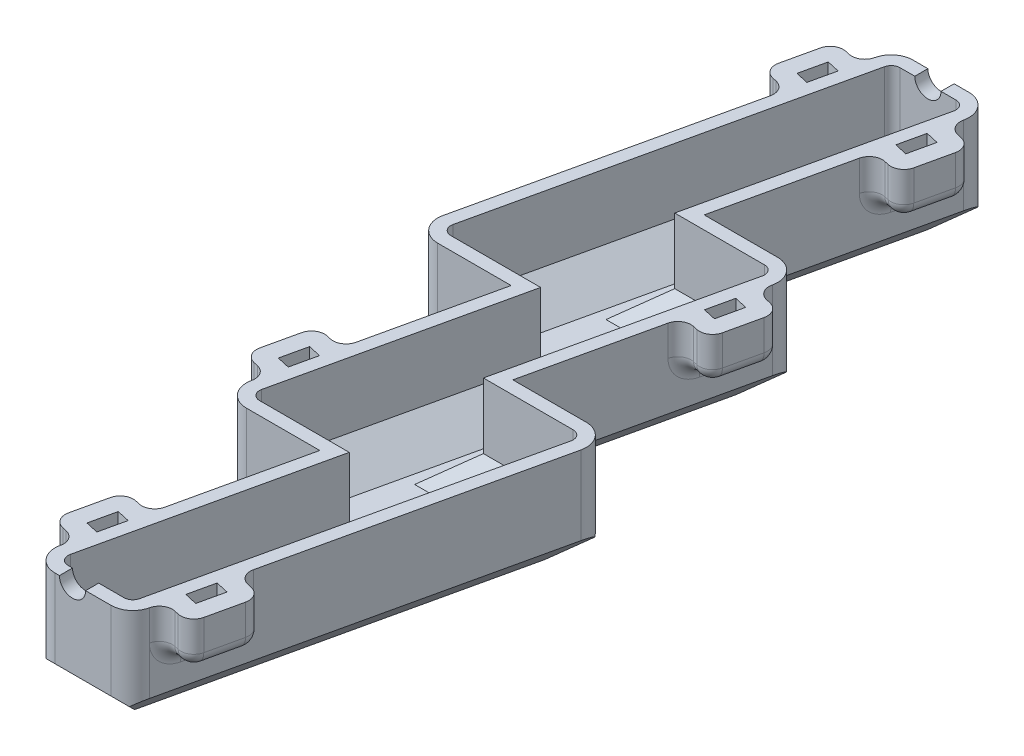
from build123d import *

# Parameters (mm, degrees)
BOSS_EXTRUDE1_DEPTH = 25
CUT_EXTRUDE1_DEPTH  = 22
CHAMFER2_SIZE       = 7
FILLET4_R           = 5
FILLET5_R           = 2
BOSS_EXTRUDE2_DEPTH = 10
FILLET6_R           = 3
SKETCH30_R          = 3
CUT_EXTRUDE2_DEPTH  = 10
SKETCH31_R          = 3
CUT_EXTRUDE3_DEPTH  = 10


with BuildPart() as part:
    # Sketch1 → Boss-Extrude1 (new body)
    with BuildSketch(Plane(origin=(0, 0, 0), x_dir=(1, 0, 0), z_dir=(0, 1, 0))):
        Polygon((-1.350541496, 45.372193924), (21.708735773, 45.372193924), (1.350541496, -45.372193924), (-21.708735773, -45.372193924), align=None)
        Polygon((12.154256572, -100), (-10.905020697, -100), (9.453173579, -9.255612153), (32.512450848, -9.255612153), align=None)
        Polygon((-12.154256572, 100), (10.905020697, 100), (-9.453173579, 9.255612153), (-32.512450848, 9.255612153), align=None)
    extrude(amount=BOSS_EXTRUDE1_DEPTH)

    # Sketch4 → Cut-Extrude1 (cut)
    with BuildSketch(Plane(origin=(0, 25, 0), x_dir=(1, 0, 0), z_dir=(0, 1, 0))):
        Polygon((-9.752726049, 97), (-28.764840766, 12.255612153), (-11.854704102, 12.255612153), (7.157410615, 97), align=None)
        Polygon((1.050989026, 42.372193924), (-5.098151579, 42.372193924), (-11.854704102, 12.255612153), (-5.705563497, 12.255612153), align=None)
        Polygon((1.050989026, 42.372193924), (-17.96112569, -42.372193924), (-1.050989026, -42.372193924), (17.96112569, 42.372193924), align=None)
        Polygon((11.854704102, -12.255612153), (-7.157410615, -97), (9.752726049, -97), (28.764840766, -12.255612153), align=None)
        Polygon((11.854704102, -12.255612153), (5.705563497, -12.255612153), (-1.050989026, -42.372193924), (5.098151579, -42.372193924), align=None)
    extrude(amount=-CUT_EXTRUDE1_DEPTH, mode=Mode.SUBTRACT)

    # Chamfer2
    chamfer2_edges = [part.edges().sort_by_distance(p)[0] for p in [
        (0.624617937, 0, 100),
        (-4.7772396, 0, 72.686096962),
        (-10.179097138, 0, 45.372193924),
        (-15.580954676, 0, 18.058290886),
        (-20.982812214, 0, -9.255612153),
        (-22.33335371, 0, -54.627806076),
        (-0.624617937, 0, -100),
        (4.7772396, 0, -72.686096962),
        (10.179097138, 0, -45.372193924),
        (15.580954676, 0, -18.058290886),
        (20.982812214, 0, 9.255612153),
        (22.33335371, 0, 54.627806076),
        (-19.258783408, 3, -54.627806076),
        (6.431487056, 3, -42.372193924),
        (17.235202131, 3, 12.255612153),
        (1.297657717, 3, 97),
        (-1.029629518, 3, 69.686096962),
        (-6.431487056, 3, 42.372193924),
        (-11.833344593, 3, 15.058290886),
        (-17.235202131, 3, -12.255612153),
        (-1.297657717, 3, -97),
        (1.029629518, 3, -69.686096962),
        (11.833344593, 3, -15.058290886),
        (19.258783408, 3, 54.627806076),
    ]]
    chamfer(chamfer2_edges, length=CHAMFER2_SIZE)

    # Fillet4
    fillet4_edges = [part.edges().sort_by_distance(p)[0] for p in [
        (12.154256572, 16, 100),
        (-10.905020697, 16, 100),
        (-21.708735773, 16, 45.372193924),
        (-32.512450848, 16, -9.255612153),
        (-12.154256572, 16, -100),
        (10.905020697, 16, -100),
        (21.708735773, 16, -45.372193924),
        (32.512450848, 16, 9.255612153),
    ]]
    fillet(fillet4_edges, radius=FILLET4_R)

    # Fillet5
    fillet5_edges = [part.edges().sort_by_distance(p)[0] for p in [
        (7.157410615, 17.5, -97),
        (17.96112569, 17.5, -42.372193924),
        (28.764840766, 17.5, 12.255612153),
        (9.752726049, 17.5, 97),
        (-7.157410615, 17.5, 97),
        (-17.96112569, 17.5, 42.372193924),
        (-28.764840766, 17.5, -12.255612153),
        (-9.752726049, 17.5, -97),
    ]]
    fillet(fillet5_edges, radius=FILLET5_R)

    # Sketch29 → Boss-Extrude2 (add)
    with BuildSketch(Plane(origin=(0, 25, 0), x_dir=(1, 0, 0), z_dir=(0, 1, 0))):
        Polygon((15.711241219, 89.445897905), (8.881018478, 90.978235108), (8.005397219, 87.075250685), (10.932635537, 86.41853474), (9.619203648, 80.564058105), (6.69196533, 81.220774049), (5.816344071, 77.317789626), (12.646566812, 75.785452422), align=None)
        Polygon((-14.562773434, 89.264303833), (-13.687152175, 93.167288256), (-20.517374916, 94.69962546), (-23.582049323, 81.039179978), (-16.751826582, 79.506842774), (-15.876205323, 83.409827197), (-18.80344364, 84.066543142), (-17.490011752, 89.921019777), align=None)
        Polygon((26.514956295, 34.818091828), (19.684733554, 36.350429032), (18.809112294, 32.447444609), (21.736350612, 31.790728664), (20.422918723, 25.936252029), (17.495680406, 26.592967973), (16.620059146, 22.68998355), (23.450281888, 21.157646346), align=None)
        Polygon((-26.514956295, -34.818091828), (-19.684733554, -36.350429032), (-18.809112294, -32.447444609), (-21.736350612, -31.790728664), (-20.422918723, -25.936252029), (-17.495680406, -26.592967973), (-16.620059146, -22.68998355), (-23.450281888, -21.157646346), align=None)
        Polygon((-15.711241219, -89.445897905), (-8.881018478, -90.978235108), (-8.005397219, -87.075250685), (-10.932635537, -86.41853474), (-9.619203648, -80.564058105), (-6.69196533, -81.220774049), (-5.816344071, -77.317789626), (-12.646566812, -75.785452422), align=None)
        Polygon((14.562773434, -89.264303833), (13.687152175, -93.167288256), (20.517374916, -94.69962546), (23.582049323, -81.039179978), (16.751826582, -79.506842774), (15.876205323, -83.409827197), (18.80344364, -84.066543142), (17.490011752, -89.921019777), align=None)
    extrude(amount=-BOSS_EXTRUDE2_DEPTH)

    # Fillet6
    fillet6_edges = [part.edges().sort_by_distance(p)[0] for p in [
        (16.620059146, 20, -22.68998355),
        (19.684733554, 20, -36.350429032),
        (5.816344071, 20, -77.317789626),
        (8.881018478, 20, -90.978235108),
        (-13.687152175, 20, -93.167288256),
        (-16.751826582, 20, -79.506842774),
        (-16.620059146, 20, 22.68998355),
        (-19.684733554, 20, 36.350429032),
        (-8.881018478, 20, 90.978235108),
        (-5.816344071, 20, 77.317789626),
        (13.687152175, 20, 93.167288256),
        (16.751826582, 20, 79.506842774),
        (23.450281888, 20, -21.157646346),
        (20.035170517, 15, -21.923814948),
        (17.057869776, 15, -24.641475761),
        (19.246922924, 15, -34.39893682),
        (24.982619091, 15, -27.987869087),
        (23.099844924, 15, -35.58426043),
        (26.514956295, 20, -34.818091828),
        (6.2541547, 15, -79.269281838),
        (8.443207848, 15, -89.026742897),
        (9.231455441, 15, -76.551621024),
        (12.646566812, 20, -75.785452422),
        (14.178904016, 15, -82.615675164),
        (15.711241219, 20, -89.445897905),
        (12.296129849, 15, -90.212066507),
        (-17.102263545, 15, -93.933456858),
        (-20.517374916, 20, -94.69962546),
        (-23.582049323, 20, -81.039179978),
        (-20.166937953, 15, -80.273011376),
        (-16.314015952, 15, -81.458334986),
        (-22.04971212, 15, -87.869402719),
        (-14.124962804, 15, -91.215796045),
        (-23.450281888, 20, 21.157646346),
        (-17.057869776, 15, 24.641475761),
        (-20.035170517, 15, 21.923814948),
        (-24.982619091, 15, 27.987869087),
        (-26.514956295, 20, 34.818091828),
        (-19.246922924, 15, 34.39893682),
        (-23.099844924, 15, 35.58426043),
        (-12.646566812, 20, 75.785452422),
        (-15.711241219, 20, 89.445897905),
        (-14.178904016, 15, 82.615675164),
        (-8.443207848, 15, 89.026742897),
        (-12.296129849, 15, 90.212066507),
        (-9.231455441, 15, 76.551621024),
        (-6.2541547, 15, 79.269281838),
        (14.124962804, 15, 91.215796045),
        (16.314015952, 15, 81.458334986),
        (20.517374916, 20, 94.69962546),
        (17.102263545, 15, 93.933456858),
        (22.04971212, 15, 87.869402719),
        (23.582049323, 20, 81.039179978),
        (20.166937953, 15, 80.273011376),
    ]]
    fillet(fillet6_edges, radius=FILLET6_R - 0.0001)  # a hair under: the kernel refuses the full size

    # Sketch30 → Cut-Extrude2 (cut)
    with BuildSketch(Plane.XY.offset(100)):
        with Locations((-0.659003893, 25)):
            Circle(SKETCH30_R)
    extrude(amount=-CUT_EXTRUDE2_DEPTH, mode=Mode.SUBTRACT)

    # Sketch31 → Cut-Extrude3 (cut)
    with BuildSketch(Plane(origin=(0, 0, -100), x_dir=(-1, 0, 0), z_dir=(0, 0, -1))):
        with Locations((1.746350904, 25)):
            Circle(SKETCH31_R)
    extrude(amount=-CUT_EXTRUDE3_DEPTH, mode=Mode.SUBTRACT)


solid = part.part
